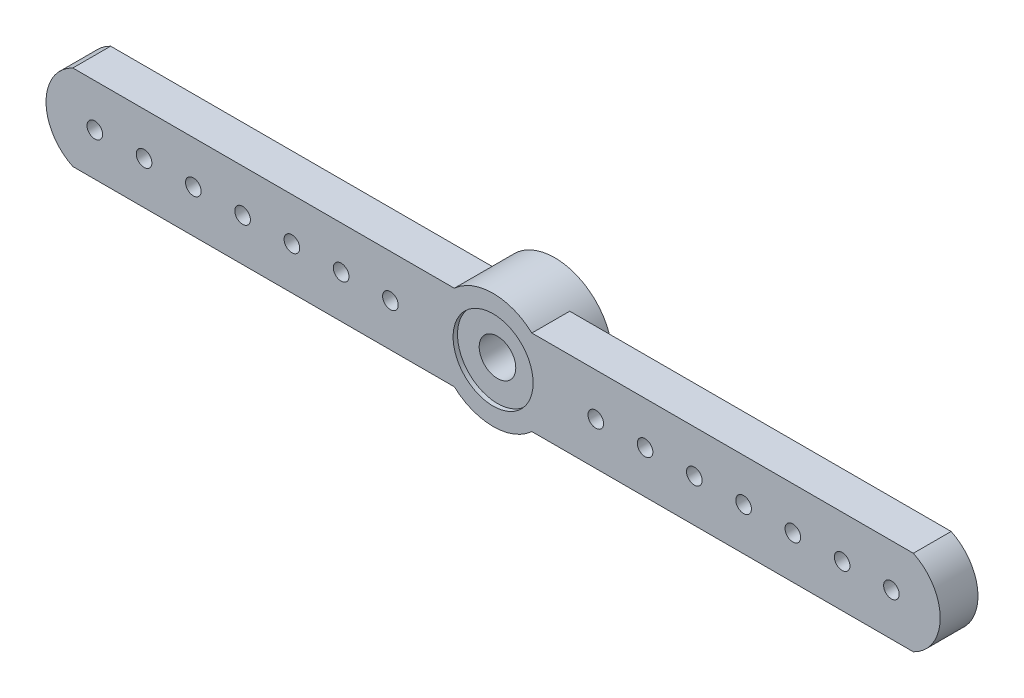
from build123d import *

# Parameters (mm, degrees)
BOSS_EXTRUDE1_DEPTH = 1.9685
SKETCH2_R           = 0.4064
CUT_EXTRUDE1_DEPTH  = 24.55446458
SKETCH3_R           = 2.0828
CUT_EXTRUDE2_DEPTH  = 0.2286
SKETCH4_R           = 0.9525
CUT_EXTRUDE3_DEPTH  = 24.536462381
BOSS_EXTRUDE2_START = 1.2446
SKETCH5_R           = 3.00355
SKETCH5_R_2         = 1.73355
BOSS_EXTRUDE2_DEPTH = 1.2446


with BuildPart() as part:
    # Sketch1 → Boss-Extrude1 (new body)
    with BuildSketch(Plane.XY):
        with BuildLine():
            Line((-2.020348077, 2.2225), (-21.8821, 2.2225))
            ThreePointArc((-21.8821, 2.2225), (-23.2791, 0), (-21.8821, -2.2225))
            Line((-21.8821, -2.2225), (-2.020348077, -2.2225))
            ThreePointArc((-2.020348077, -2.2225), (0, -3.00355), (2.020348077, -2.2225))
            Line((2.020348077, -2.2225), (21.8821, -2.2225))
            ThreePointArc((21.8821, -2.2225), (23.2791, 0), (21.8821, 2.2225))
            Line((21.8821, 2.2225), (2.020348077, 2.2225))
            ThreePointArc((2.020348077, 2.2225), (0, 3.00355), (-2.020348077, 2.2225))
        make_face()
    extrude(amount=BOSS_EXTRUDE1_DEPTH)

    # Sketch2 → Cut-Extrude1 (cut, through all)
    with BuildSketch(Plane.XY.offset(1.9685)):
        with Locations((-20.7391, 0)):
            Circle(SKETCH2_R)
        with Locations((-18.1737, 0)):
            Circle(SKETCH2_R)
        with Locations((-15.6083, 0)):
            Circle(SKETCH2_R)
        with Locations((-13.0429, 0)):
            Circle(SKETCH2_R)
        with Locations((-10.4775, 0)):
            Circle(SKETCH2_R)
        with Locations((-7.9121, 0)):
            Circle(SKETCH2_R)
        with Locations((-5.3467, 0)):
            Circle(SKETCH2_R)
        with Locations((5.3467, 0)):
            Circle(SKETCH2_R)
        with Locations((7.9121, 0)):
            Circle(SKETCH2_R)
        with Locations((10.4775, 0)):
            Circle(SKETCH2_R)
        with Locations((13.0429, 0)):
            Circle(SKETCH2_R)
        with Locations((15.6083, 0)):
            Circle(SKETCH2_R)
        with Locations((18.1737, 0)):
            Circle(SKETCH2_R)
        with Locations((20.7391, 0)):
            Circle(SKETCH2_R)
    extrude(amount=-CUT_EXTRUDE1_DEPTH, mode=Mode.SUBTRACT)

    # Sketch3 → Cut-Extrude2 (cut)
    with BuildSketch(Plane.XY.offset(1.9685)):
        Circle(SKETCH3_R)
    extrude(amount=-CUT_EXTRUDE2_DEPTH, mode=Mode.SUBTRACT)

    # Sketch4 → Cut-Extrude3 (cut, through all)
    with BuildSketch(Plane.XY.offset(1.7399)):
        Circle(SKETCH4_R)
    extrude(amount=-CUT_EXTRUDE3_DEPTH, mode=Mode.SUBTRACT)

    # Sketch5 → Boss-Extrude2 (add)
    with BuildSketch(Plane(origin=(0, 0, 0), x_dir=(-1, 0, 0), z_dir=(0, 0, -1)).offset(BOSS_EXTRUDE2_START)):
        Circle(SKETCH5_R)
        Circle(SKETCH5_R_2, mode=Mode.SUBTRACT)
    extrude(amount=-BOSS_EXTRUDE2_DEPTH)


solid = part.part
